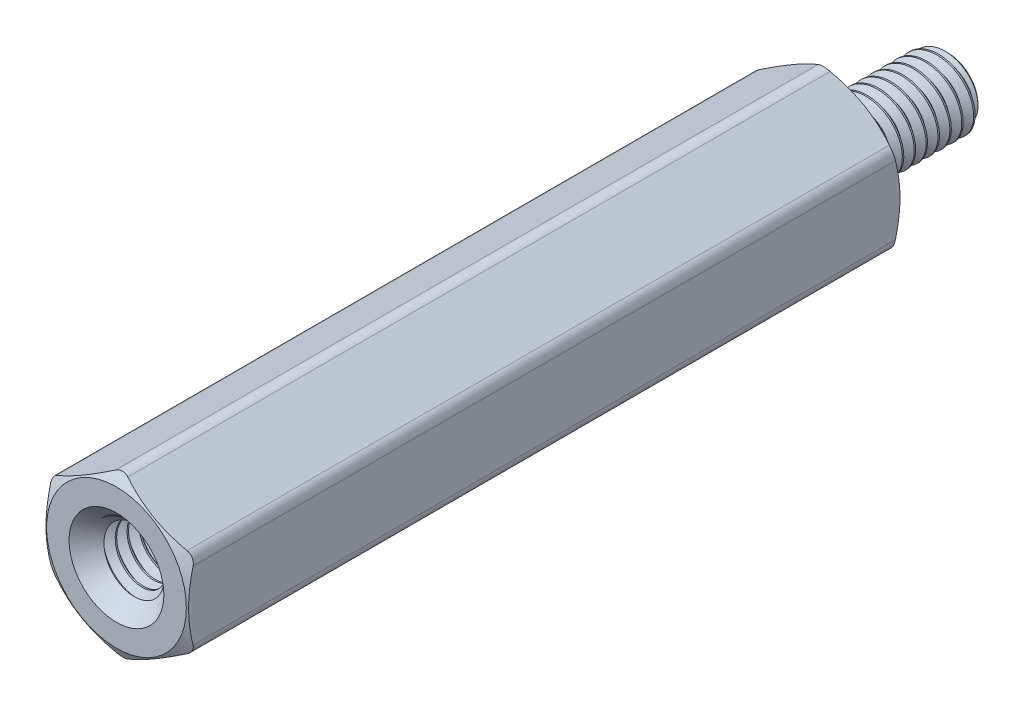
from build123d import *

# Parameters (mm, degrees)
SKETCH4_R           = 2.25
BOSS_EXTRUDE1_DEPTH = 30
SKETCH5_OUTSIDE_W   = 140.978
SKETCH5_OUTSIDE_H   = 141.906
SKETCH5_OUTSIDE_R   = 2.94
CUT_EXTRUDE1_DEPTH  = 36.298725189
CUT_EXTRUDE1_DRAFT  = -60
SKETCH6_OUTSIDE_W   = 123.828
SKETCH6_OUTSIDE_H   = 124.756
SKETCH6_OUTSIDE_R   = 2.94
CUT_EXTRUDE2_DEPTH  = 31.347981811
CUT_EXTRUDE2_DRAFT  = -60
FILLET1_R           = 0.51
CUT_SWEEP1_PITCH    = 0.5
SKETCH9_R           = 1.75
BOSS_EXTRUDE2_DEPTH = 6.4
SKETCH10_W          = 6.4
SKETCH10_H          = 1.5
CUT_SWEEP2_PITCH    = 0.5


with BuildPart() as part:
    # Sketch3 → Revolve1 (revolve)
    with BuildSketch(Plane(origin=(0, 0, 0), x_dir=(0, 0, -1), z_dir=(1, 0, 0))):
        with BuildLine():
            Line((-23.6, 1.25), (-23.6, 0))
            Line((-23.6, 0), (5, 0))
            Line((5, 0), (5, 1.25))
            Line((5, 1.25), (4.75, 1.5))
            Line((4.75, 1.5), (0.7875, 1.5))
            Line((0.7875, 1.5), (0.6, 1.175240474))
            Line((0.6, 1.175240474), (0.25, 1.175240474))
            ThreePointArc((0.25, 1.175240474), (0.073223305, 1.248463778), (0, 1.425240474))
            Line((0, 1.425240474), (0, 3))
            Line((0, 3), (-30, 3))
            Line((-30, 3), (-30, 1.75))
            Line((-30, 1.75), (-29.75, 1.5))
            Line((-29.75, 1.5), (-23.85, 1.5))
            Line((-23.85, 1.5), (-23.6, 1.25))
        make_face()
    revolve(axis=Axis((0, 0, -5), (0, 0, 1)))

    # Sketch4 → Boss-Extrude1 (add)
    with BuildSketch(Plane.XY.offset(30)):
        Polygon((-3, 1.732050808), (-3, -1.732050808), (0, -3.464101615), (3, -1.732050808), (3, 1.732050808), (0, 3.464101615), align=None)
        Circle(SKETCH4_R, mode=Mode.SUBTRACT)
    extrude(amount=-BOSS_EXTRUDE1_DEPTH)


with BuildPart() as cut_extrude1_tool:
    # Sketch5 outside → Cut-Extrude1 (with draft: the straight prism first)
    with BuildSketch(Plane.XY.offset(30)):
        Rectangle(SKETCH5_OUTSIDE_W, SKETCH5_OUTSIDE_H)
        Circle(SKETCH5_OUTSIDE_R, mode=Mode.SUBTRACT)
    extrude(amount=-CUT_EXTRUDE1_DEPTH)
    # Cut-Extrude1: the draft: its side faces are tilted about the plane it starts from
    cut_extrude1_sides = [cut_extrude1_tool.faces().sort_by_distance(p)[0] for p in [
        (0, -70.953, 11.850637405),
        (70.489, 0, 11.850637405),
        (0, 70.953, 11.850637405),
        (-70.489, 0, 11.850637405),
        (-2.94, 0, 11.850637405),
    ]]
    draft(cut_extrude1_sides, Plane.XY.offset(30), CUT_EXTRUDE1_DRAFT)


with BuildPart() as part_1:
    add(part.part)

    # Cut-Extrude1: cut by cut_extrude1_tool
    add(cut_extrude1_tool.part, mode=Mode.SUBTRACT)


with BuildPart() as cut_extrude2_tool:
    # Sketch6 outside → Cut-Extrude2 (with draft: the straight prism first)
    with BuildSketch(Plane(origin=(0, 0, 0), x_dir=(-1, 0, 0), z_dir=(0, 0, -1))):
        Rectangle(SKETCH6_OUTSIDE_W, SKETCH6_OUTSIDE_H)
        Circle(SKETCH6_OUTSIDE_R, mode=Mode.SUBTRACT)
    extrude(amount=-CUT_EXTRUDE2_DEPTH)
    # Cut-Extrude2: the draft: its side faces are tilted about the plane it starts from
    cut_extrude2_sides = [cut_extrude2_tool.faces().sort_by_distance(p)[0] for p in [
        (0, -62.378, 15.673990905),
        (-61.914, 0, 15.673990905),
        (0, 62.378, 15.673990905),
        (61.914, 0, 15.673990905),
        (2.94, 0, 15.673990905),
    ]]
    draft(cut_extrude2_sides, Plane(origin=(0, 0, 0), x_dir=(-1, 0, 0), z_dir=(0, 0, -1)), CUT_EXTRUDE2_DRAFT)


with BuildPart() as part_2:
    add(part_1.part)

    # Cut-Extrude2: cut by cut_extrude2_tool
    add(cut_extrude2_tool.part, mode=Mode.SUBTRACT)

    # Fillet1
    fillet1_edges = [part_2.edges().sort_by_distance(p)[0] for p in [
        (0, 3.464101615, 15),
        (-3, -1.732050808, 15),
        (0, -3.464101615, 15),
        (3, -1.732050808, 15),
        (3, 1.732050808, 15),
        (-3, 1.732050808, 15),
    ]]
    fillet(fillet1_edges, radius=FILLET1_R)

    # Cut-Sweep1: the profile of Sketch7 profile screwed along a right-hand helix of 9.7 turns, 6 arcs to a turn; built about Z, then put on its axis
    cut_sweep1_z = Axis((0, 0, 0), (0, 0, 1))
    cut_sweep1_corners = [(1.174940474, 0, -0.187673205), (1.174940474, 0, -0.249826795), (1.527063294, 0, -0.453125), (1.527063294, 0, 0.015625)]
    with BuildLine(mode=Mode.PRIVATE) as cut_sweep1_profile:
        Line(cut_sweep1_corners[0], cut_sweep1_corners[1])
        Line(cut_sweep1_corners[1], cut_sweep1_corners[2])
        Line(cut_sweep1_corners[2], cut_sweep1_corners[3])
        Line(cut_sweep1_corners[3], cut_sweep1_corners[0])
    cut_sweep1_cap = Face(cut_sweep1_profile.wire())
    cut_sweep1_turn_angles = [0, 30, 60, 90, 120, 150, 180, 210, 240, 270, 300, 330, 360]
    cut_sweep1_turn_weights = [1, 0.8660254037844387, 1, 0.8660254037844387, 1, 0.8660254037844387, 1, 0.8660254037844387, 1, 0.8660254037844387, 1, 0.8660254037844387, 1]
    cut_sweep1_turn_rails = [Edge.make_bspline([Vector(p[0], p[1], 0).rotate(cut_sweep1_z, cut_sweep1_turn_angles[k]) / cut_sweep1_turn_weights[k] + Vector(0, 0, p[2] + CUT_SWEEP1_PITCH * cut_sweep1_turn_angles[k] / 360) for k in range(13)], [0, 0, 0, 1, 1, 2, 2, 3, 3, 4, 4, 5, 5, 6, 6, 6], 2, cut_sweep1_turn_weights) for p in cut_sweep1_corners]
    cut_sweep1_turn_sides = [Face.make_surface_from_curves(cut_sweep1_turn_rails[p[0]], cut_sweep1_turn_rails[p[1]]) for p in [(0, 1), (1, 2), (2, 3), (3, 0)]]
    cut_sweep1_last_angles = [3240, 3270, 3300, 3330, 3360, 3390, 3420, 3450, 3480, 3486, 3492]
    cut_sweep1_last_weights = [1, 0.8660254037844387, 1, 0.8660254037844387, 1, 0.8660254037844387, 1, 0.8660254037844387, 1, 0.9945218953682634, 1]
    cut_sweep1_last_rails = [Edge.make_bspline([Vector(p[0], p[1], 0).rotate(cut_sweep1_z, cut_sweep1_last_angles[k]) / cut_sweep1_last_weights[k] + Vector(0, 0, p[2] + CUT_SWEEP1_PITCH * cut_sweep1_last_angles[k] / 360) for k in range(11)], [0, 0, 0, 1, 1, 2, 2, 3, 3, 4, 4, 5, 5, 5], 2, cut_sweep1_last_weights) for p in cut_sweep1_corners]
    cut_sweep1_last_sides = [Face.make_surface_from_curves(cut_sweep1_last_rails[p[0]], cut_sweep1_last_rails[p[1]]) for p in [(0, 1), (1, 2), (2, 3), (3, 0)]]
    cut_sweep1 = Plane(origin=(0, 0, -5), x_dir=(0, 1, 0), z_dir=(0, 0, 1)) * Solid(Shell([*[p.moved(Location((0, 0, CUT_SWEEP1_PITCH * i))) for i in range(9) for p in cut_sweep1_turn_sides], *cut_sweep1_last_sides, cut_sweep1_cap, cut_sweep1_cap.rotate(cut_sweep1_z, 3492).moved(Location((0, 0, CUT_SWEEP1_PITCH * 3492 / 360)))]))
    add(cut_sweep1, mode=Mode.SUBTRACT)

    # Sketch9 → Boss-Extrude2 (add)
    with BuildSketch(Plane.XY.offset(23.6)):
        Circle(SKETCH9_R)
    extrude(amount=BOSS_EXTRUDE2_DEPTH)


with BuildPart() as body_2:
    # Sketch10 → Revolve2 (revolve)
    with BuildSketch(Plane(origin=(0, 0, 0), x_dir=(0, 0, -1), z_dir=(1, 0, 0))):
        with Locations((-26.8, 0.75)):
            Rectangle(SKETCH10_W, SKETCH10_H)
    revolve(axis=Axis((0, 0, -5), (0, 0, 1)))

    # Cut-Sweep2: the profile of Sketch12 profile screwed along a right-hand helix of 13.8 turns, 6 arcs to a turn; built about Z, then put on its axis
    cut_sweep2_z = Axis((0, 0, 0), (0, 0, 1))
    cut_sweep2_corners = [(1.174940474, 0, -0.249826795), (1.174940474, 0, -0.187673205), (1.527063294, 0, 0.015625), (1.527063294, 0, -0.453125)]
    with BuildLine(mode=Mode.PRIVATE) as cut_sweep2_profile:
        Line(cut_sweep2_corners[0], cut_sweep2_corners[1])
        Line(cut_sweep2_corners[1], cut_sweep2_corners[2])
        Line(cut_sweep2_corners[2], cut_sweep2_corners[3])
        Line(cut_sweep2_corners[3], cut_sweep2_corners[0])
    cut_sweep2_cap = Face(cut_sweep2_profile.wire())
    cut_sweep2_turn_angles = [0, 30, 60, 90, 120, 150, 180, 210, 240, 270, 300, 330, 360]
    cut_sweep2_turn_weights = [1, 0.8660254037844387, 1, 0.8660254037844387, 1, 0.8660254037844387, 1, 0.8660254037844387, 1, 0.8660254037844387, 1, 0.8660254037844387, 1]
    cut_sweep2_turn_rails = [Edge.make_bspline([Vector(p[0], p[1], 0).rotate(cut_sweep2_z, cut_sweep2_turn_angles[k]) / cut_sweep2_turn_weights[k] + Vector(0, 0, p[2] + CUT_SWEEP2_PITCH * cut_sweep2_turn_angles[k] / 360) for k in range(13)], [0, 0, 0, 1, 1, 2, 2, 3, 3, 4, 4, 5, 5, 6, 6, 6], 2, cut_sweep2_turn_weights) for p in cut_sweep2_corners]
    cut_sweep2_turn_sides = [Face.make_surface_from_curves(cut_sweep2_turn_rails[p[0]], cut_sweep2_turn_rails[p[1]]) for p in [(0, 1), (1, 2), (2, 3), (3, 0)]]
    cut_sweep2_last_angles = [4680, 4710, 4740, 4770, 4800, 4830, 4860, 4890, 4920, 4944, 4968]
    cut_sweep2_last_weights = [1, 0.8660254037844387, 1, 0.8660254037844387, 1, 0.8660254037844387, 1, 0.8660254037844387, 1, 0.9135454576426073, 1]
    cut_sweep2_last_rails = [Edge.make_bspline([Vector(p[0], p[1], 0).rotate(cut_sweep2_z, cut_sweep2_last_angles[k]) / cut_sweep2_last_weights[k] + Vector(0, 0, p[2] + CUT_SWEEP2_PITCH * cut_sweep2_last_angles[k] / 360) for k in range(11)], [0, 0, 0, 1, 1, 2, 2, 3, 3, 4, 4, 5, 5, 5], 2, cut_sweep2_last_weights) for p in cut_sweep2_corners]
    cut_sweep2_last_sides = [Face.make_surface_from_curves(cut_sweep2_last_rails[p[0]], cut_sweep2_last_rails[p[1]]) for p in [(0, 1), (1, 2), (2, 3), (3, 0)]]
    cut_sweep2 = Plane(origin=(0, 0, 30), x_dir=(0, 1, 0), z_dir=(0, 0, -1)) * Solid(Shell([*[p.moved(Location((0, 0, CUT_SWEEP2_PITCH * i))) for i in range(13) for p in cut_sweep2_turn_sides], *cut_sweep2_last_sides, cut_sweep2_cap, cut_sweep2_cap.rotate(cut_sweep2_z, 4968).moved(Location((0, 0, CUT_SWEEP2_PITCH * 4968 / 360)))]))
    add(cut_sweep2, mode=Mode.SUBTRACT)


with BuildPart() as part_3:
    add(part_2.part)

    # Combine1: cut body 2
    add(body_2.part, mode=Mode.SUBTRACT)

    # Cut-Extrude3 cone 1 section (through the dimple's axis) → Cut-Extrude3 (revolve, cut)
    with BuildSketch(Plane(origin=(0, 0, 30), x_dir=(0, -1, 0), z_dir=(1, 0, 0))):
        Polygon((0, 0), (1.995, 0), (0, 1.995), align=None)
    revolve(axis=Axis((0, 0, 30), (0, 0, -1)), mode=Mode.SUBTRACT)


solid = part_3.part
